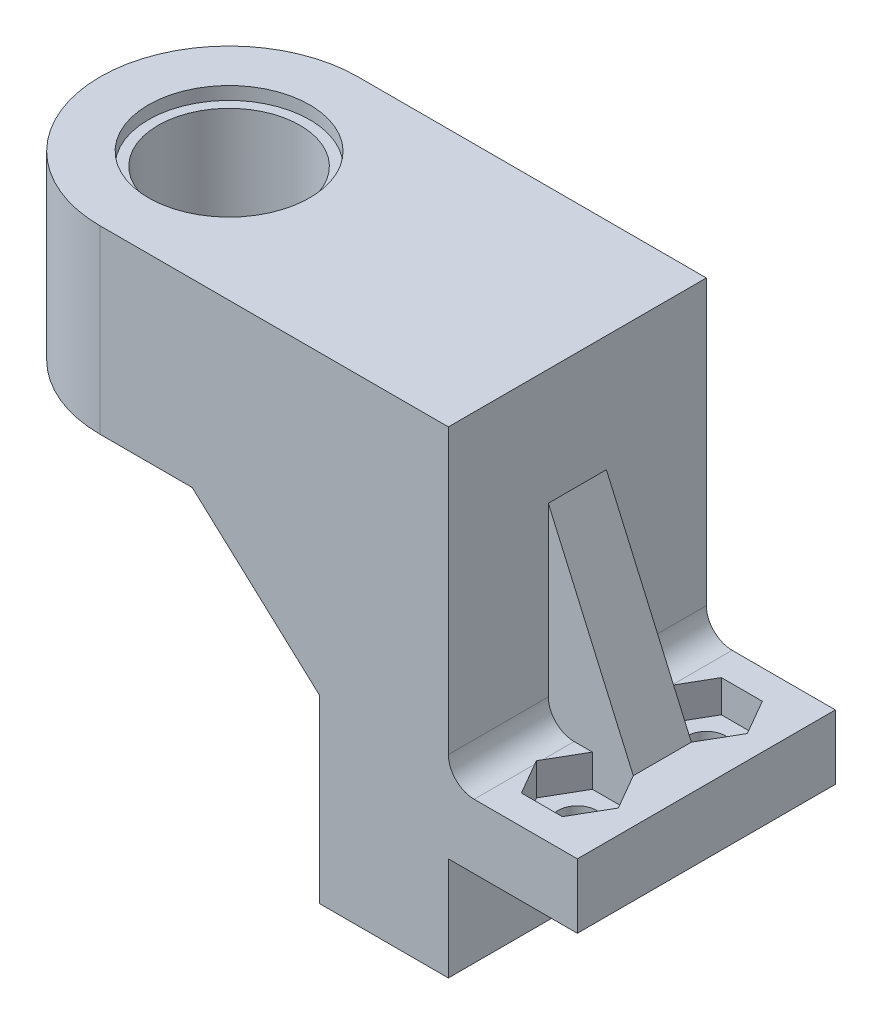
from build123d import *
from build123d.topology import SkipClean

# Parameters (mm, degrees)
EXTRUDE_1_DEPTH           = 20
SKETCH_3_R                = 5.5
CUT_EXTRUDE_2_DEPTH       = 10
SKETCH_9_R                = 6.25
CUT_EXTRUDE_6_DEPTH       = 1
SKETCH_11_W               = 20
SKETCH_11_H               = 5
EXTRUDE_4_DEPTH           = 10
CUT_EXTRUDE_8_REACH       = 78.472
SKETCH_12_R               = 1.5
SKETCH_13_R               = 3
CUT_EXTRUDE_9_DEPTH       = 2.5
SKETCH_14_R               = 10
SKETCH_14_R_2             = 5.5
EXTRUDE_5_DEPTH           = 6
CUT_EXTRUDE_START         = -1
SKETCH_6_R                = 6.25
CUT_EXTRUDE_10_DEPTH      = 1
SKETCH_15_W               = 20
SKETCH_15_H               = 5
EXTRUDE_6_DEPTH           = 5
SKETCH_16_W               = 17
SKETCH_16_H               = 3
EXTRUDE_7_DEPTH           = 15
CUT_EXTRUDE_11_DEPTH      = 70.961190435
CUT_EXTRUDE_11_DEPTH_BACK = 70.961190435
EXTRUDE_START             = -5
SKETCH_3D_3_R             = 1.5
EXTRUDE_8_DEPTH           = 5
CUT_EXTRUDE_12_DEPTH      = 2.5
FILLET_1_R                = 2
CUT_EXTRUDE_14_DEPTH      = 76.06644022
SKETCH_21_W               = 6.587713241
SKETCH_21_H               = 4.5
EXTRUDE_9_DEPTH           = 15
SKETCH_23_W               = 25
SKETCH_23_H               = 20
CUT_EXTRUDE_16_DEPTH      = 5
CUT_EXTRUDE_17_DEPTH      = 10


with BuildPart() as part:
    # 草图1 → 凸台-拉伸1 (new body)
    with BuildSketch(Plane.XY):
        Polygon((-63.866818046, 22.947717095), (-23.866818046, 22.947717095), (-23.866818046, -19.052282905), (-33.866818046, -19.052282905), (-33.866818046, 14.947717095), (-63.866818046, 14.947717095), align=None)
    extrude(amount=EXTRUDE_1_DEPTH)

    # 草图3 → 切除-拉伸2 (cut)
    with BuildSketch(Plane(origin=(0, 22.947717095, 0), x_dir=(-1, 0, 0), z_dir=(0, 1, 0))):
        with Locations((50.866818046, 10)):
            Circle(SKETCH_3_R)
    extrude(amount=-CUT_EXTRUDE_2_DEPTH, mode=Mode.SUBTRACT)

    # 草图9 → 切除-拉伸6 (cut)
    with BuildSketch(Plane(origin=(0, 22.947717095, 0), x_dir=(1, 0, 0), z_dir=(0, 1, 0))):
        with Locations(Location((-50.866818046, -10, 0), (0, 0, 180))):
            Circle(SKETCH_9_R)
    extrude(amount=-CUT_EXTRUDE_6_DEPTH, mode=Mode.SUBTRACT)

    # 草图11 → 凸台-拉伸4 (add)
    with BuildSketch(Plane(origin=(-23.866818046, 0, 0), x_dir=(0, 0, -1), z_dir=(1, 0, 0))):
        with Locations((-10, -16.552282905)):
            Rectangle(SKETCH_11_W, SKETCH_11_H)
    extrude(amount=EXTRUDE_4_DEPTH)

    # 草图12 → 切除-拉伸8 (cut, up to next)
    with BuildSketch(Plane(origin=(0, -14.052282905, 0), x_dir=(-1, 0, 0), z_dir=(0, 1, 0)), mode=Mode.PRIVATE) as cut_extrude_8_sk1:
        with Locations((18.866818046, 5)):
            Circle(SKETCH_12_R)
    cut_extrude_8_tool1 = extrude(cut_extrude_8_sk1.sketch, amount=-CUT_EXTRUDE_8_REACH, mode=Mode.PRIVATE) & part.part
    # 草图12 → 切除-拉伸8 (cut, up to next)
    with BuildSketch(Plane(origin=(0, -14.052282905, 0), x_dir=(-1, 0, 0), z_dir=(0, 1, 0)), mode=Mode.PRIVATE) as cut_extrude_8_sk2:
        with Locations((18.866818046, 15)):
            Circle(SKETCH_12_R)
    cut_extrude_8_tool2 = extrude(cut_extrude_8_sk2.sketch, amount=-CUT_EXTRUDE_8_REACH, mode=Mode.PRIVATE) & part.part
    add(cut_extrude_8_tool1.solids().sort_by_distance((-18.866818, -14.052283, 5))[0], mode=Mode.SUBTRACT)
    add(cut_extrude_8_tool2.solids().sort_by_distance((-18.866818, -14.052283, 15))[0], mode=Mode.SUBTRACT)

    # 草图13 → 切除-拉伸9 (cut)
    with BuildSketch(Plane.XZ.offset(19.052282905)):
        with Locations(Location((-18.866818046, 15, 0), (0, 0, 270))):
            Circle(SKETCH_13_R)
        with Locations(Location((-18.866818046, 5, 0), (0, 0, 270))):
            Circle(SKETCH_13_R)
    extrude(amount=-CUT_EXTRUDE_9_DEPTH, mode=Mode.SUBTRACT)

    # 草图14 → 凸台-拉伸5 (add)
    with SkipClean():  # the faces are left unmerged after this step: merging them gives an invalid solid
        with BuildSketch(Plane.XZ.offset(-14.947717095)):
            with Locations(Location((-50.866818046, 10, 0), (0, 0, 270))):
                Circle(SKETCH_14_R)
            with Locations(Location((-50.866818046, 10, 0), (0, 0, 180))):
                Circle(SKETCH_14_R_2, mode=Mode.SUBTRACT)
        extrude(amount=EXTRUDE_5_DEPTH)

    # 草图6 → 切除-拉伸10 (cut)
    with BuildSketch(Plane.XZ.offset(-8.947717095).offset(CUT_EXTRUDE_START)):
        with Locations(Location((-50.866818046, 10, 0), (0, 0, 180))):
            Circle(SKETCH_6_R)
    extrude(amount=CUT_EXTRUDE_10_DEPTH, mode=Mode.SUBTRACT)

    # 草图15 → 凸台-拉伸6 (add)
    with BuildSketch(Plane(origin=(-13.866818046, 0, 0), x_dir=(0, 0, -1), z_dir=(1, 0, 0))):
        with Locations((-10, -16.552282905)):
            Rectangle(SKETCH_15_W, SKETCH_15_H)
    extrude(amount=EXTRUDE_6_DEPTH)

    # 草图16 → 凸台-拉伸7 (add)
    with BuildSketch(Plane.XZ.offset(-14.947717095)):
        with Locations((-42.366818046, 18.5)):
            Rectangle(SKETCH_16_W, SKETCH_16_H)
        with Locations((-42.366818046, 1.5)):
            Rectangle(SKETCH_16_W, SKETCH_16_H)
    extrude(amount=EXTRUDE_7_DEPTH)

    # 草图17 → 切除-拉伸11 (cut, two sides: drawn at the far end of the back side and taken through both)
    with BuildSketch(Plane(origin=(0, 0, 17), x_dir=(-1, 0, 0), z_dir=(0, 0, -1)).offset(-CUT_EXTRUDE_11_DEPTH_BACK)):
        Polygon((50.866818046, 8.947717095), (43.725389617, 8.947717095), (33.866818046, -0.052282905), (50.866818046, -0.052282905), align=None)
    extrude(amount=CUT_EXTRUDE_11_DEPTH + CUT_EXTRUDE_11_DEPTH_BACK, mode=Mode.SUBTRACT)

    # Sketch 3D_3 → 凸台-拉伸8 (add)
    with BuildSketch(Plane(origin=(-23.866818046, -6.052282905, 20), x_dir=(0.447213595499958, 0, -0.894427190999916), z_dir=(0, -1, 0)).offset(EXTRUDE_START)):
        Polygon((0, 0), (4.472135955, 8.94427191), (22.360679775, 0), (17.88854382, -8.94427191), align=None)
        with Locations(Location((6.708203932, 2.236067977, 0), (0, 0, 243.434948823))):
            Circle(SKETCH_3D_3_R, mode=Mode.SUBTRACT)
        with Locations(Location((15.652475842, -2.236067977, 0), (0, 0, 243.434948823))):
            Circle(SKETCH_3D_3_R, mode=Mode.SUBTRACT)
    extrude(amount=EXTRUDE_8_DEPTH)

    # 草图18 → 切除-拉伸12 (cut)
    with BuildSketch(Plane(origin=(0, -1.052282905, 0), x_dir=(-1, 0, 0), z_dir=(0, 1, 0))):
        Polygon((15.691391565, 15), (17.279104805, 12.25), (20.454531286, 12.25), (22.042244526, 15), (20.454531286, 17.75), (17.279104805, 17.75), align=None)
        Polygon((15.691391565, 5), (17.279104805, 2.25), (20.454531286, 2.25), (22.042244526, 5), (20.454531286, 7.75), (17.279104805, 7.75), align=None)
    extrude(amount=-CUT_EXTRUDE_12_DEPTH, mode=Mode.SUBTRACT)

    # 圆角1
    # the kernel refuses this fillet: 2 mm, written as the material it adds along each edge
    with BuildSketch(Plane(origin=(-23.866818046, -1.052282905, 0), x_dir=(0, 1, 0), z_dir=(0, 0, 1))) as fillet_1_piece_1_section:
        with BuildLine():
            CenterArc((FILLET_1_R, -FILLET_1_R), FILLET_1_R, 90, 90)
            Line((0, -FILLET_1_R), (0, 0))
            Line((0, 0), (FILLET_1_R, 0))
        make_face()
    fillet_1_piece_1 = extrude(amount=20, mode=Mode.PRIVATE)
    fillet_1_piece_1 = split(fillet_1_piece_1, bisect_by=Plane(origin=(-20.802583542, -0.671658343, 2.852844192), z_dir=(-0.8660254037844387, 0, -0.5000000000000001)), keep=Keep.TOP, mode=Mode.PRIVATE)
    fillet_1_piece_1 = split(fillet_1_piece_1, bisect_by=Plane(origin=(-23.907001975, -0.671658343, 1.770145354), z_dir=(0.8660254037844387, 0, -0.5000000000000003)), keep=Keep.TOP, mode=Mode.PRIVATE)
    add(fillet_1_piece_1)
    with BuildSketch(Plane(origin=(-23.866818046, -1.052282905, 0), x_dir=(0, 1, 0), z_dir=(0, 0, 1))) as fillet_1_piece_2_section:
        with BuildLine():
            CenterArc((FILLET_1_R, -FILLET_1_R), FILLET_1_R, 90, 90)
            Line((0, -FILLET_1_R), (0, 0))
            Line((0, 0), (FILLET_1_R, 0))
        make_face()
    fillet_1_piece_2 = extrude(amount=20, mode=Mode.PRIVATE)
    fillet_1_piece_2 = split(fillet_1_piece_2, bisect_by=Plane(origin=(-22.4188867, -0.519681884, 5.652363381), z_dir=(-0.8660254037844387, 0, -0.5000000000000001)), keep=Keep.TOP, mode=Mode.PRIVATE)
    fillet_1_piece_2 = split(fillet_1_piece_2, bisect_by=Plane(origin=(-22.4188867, -0.519681884, 4.347636619), z_dir=(-0.8660254037844387, 0, 0.5000000000000003)), keep=Keep.TOP, mode=Mode.PRIVATE)
    add(fillet_1_piece_2)
    with BuildSketch(Plane(origin=(-23.866818046, -1.052282905, 0), x_dir=(0, 1, 0), z_dir=(0, 0, 1))) as fillet_1_piece_3_section:
        with BuildLine():
            CenterArc((FILLET_1_R, -FILLET_1_R), FILLET_1_R, 90, 90)
            Line((0, -FILLET_1_R), (0, 0))
            Line((0, 0), (FILLET_1_R, 0))
        make_face()
    fillet_1_piece_3 = extrude(amount=20, mode=Mode.PRIVATE)
    fillet_1_piece_3 = split(fillet_1_piece_3, bisect_by=Plane(origin=(-24.519856268, -0.671658343, 9.291349419), z_dir=(0.8660254037844387, 0, 0.5000000000000001)), keep=Keep.TOP, mode=Mode.PRIVATE)
    fillet_1_piece_3 = split(fillet_1_piece_3, bisect_by=Plane(origin=(-20.189729249, -0.671658343, 8.208650581), z_dir=(-0.8660254037844387, 0, 0.5000000000000003)), keep=Keep.TOP, mode=Mode.PRIVATE)
    fillet_1_piece_3 = split(fillet_1_piece_3, bisect_by=Plane(origin=(-20.189729249, -0.671658343, 11.791349419), z_dir=(-0.8660254037844387, 0, -0.5)), keep=Keep.TOP, mode=Mode.PRIVATE)
    fillet_1_piece_3 = split(fillet_1_piece_3, bisect_by=Plane(origin=(-24.519856268, -0.671658343, 10.708650581), z_dir=(0.8660254037844384, 0, -0.5000000000000004)), keep=Keep.TOP, mode=Mode.PRIVATE)
    add(fillet_1_piece_3)
    with BuildSketch(Plane(origin=(-23.866818046, -1.052282905, 0), x_dir=(0, 1, 0), z_dir=(0, 0, 1))) as fillet_1_piece_4_section:
        with BuildLine():
            CenterArc((FILLET_1_R, -FILLET_1_R), FILLET_1_R, 90, 90)
            Line((0, -FILLET_1_R), (0, 0))
            Line((0, 0), (FILLET_1_R, 0))
        make_face()
    fillet_1_piece_4 = extrude(amount=20, mode=Mode.PRIVATE)
    fillet_1_piece_4 = split(fillet_1_piece_4, bisect_by=Plane(origin=(-22.4188867, -0.519681884, 15.652363381), z_dir=(-0.8660254037844387, 0, -0.5)), keep=Keep.TOP, mode=Mode.PRIVATE)
    fillet_1_piece_4 = split(fillet_1_piece_4, bisect_by=Plane(origin=(-22.4188867, -0.519681884, 14.347636619), z_dir=(-0.8660254037844384, 0, 0.5000000000000004)), keep=Keep.TOP, mode=Mode.PRIVATE)
    add(fillet_1_piece_4)
    with BuildSketch(Plane(origin=(-23.866818046, -1.052282905, 0), x_dir=(0, 1, 0), z_dir=(0, 0, 1))) as fillet_1_piece_5_section:
        with BuildLine():
            CenterArc((FILLET_1_R, -FILLET_1_R), FILLET_1_R, 90, 90)
            Line((0, -FILLET_1_R), (0, 0))
            Line((0, 0), (FILLET_1_R, 0))
        make_face()
    fillet_1_piece_5 = extrude(amount=20, mode=Mode.PRIVATE)
    fillet_1_piece_5 = split(fillet_1_piece_5, bisect_by=Plane(origin=(-23.907001975, -0.671658343, 18.229854646), z_dir=(0.8660254037844387, 0, 0.5)), keep=Keep.TOP, mode=Mode.PRIVATE)
    fillet_1_piece_5 = split(fillet_1_piece_5, bisect_by=Plane(origin=(-20.802583542, -0.671658343, 17.147155808), z_dir=(-0.8660254037844384, 0, 0.5000000000000004)), keep=Keep.TOP, mode=Mode.PRIVATE)
    add(fillet_1_piece_5)

    # 草图20 → 切除-拉伸14 (cut, through all)
    with SkipClean():  # the faces are left unmerged after this step: merging them gives an invalid solid
        with BuildSketch(Plane.XZ.offset(-14.947717095)):
            with BuildLine():
                Line((-63.866818046, 20), (-50.866818046, 20))
                ThreePointArc((-50.866818046, 20), (-60.866818046, 10), (-50.866818046, 0))
                Line((-50.866818046, 0), (-63.866818046, 0))
                Line((-63.866818046, 0), (-63.866818046, 20))
            make_face()
        extrude(amount=-CUT_EXTRUDE_14_DEPTH, mode=Mode.SUBTRACT)
    add(part.part.scale(1), mode=Mode.REPLACE)  # the faces are merged on a copy

    # 草图21 → 凸台-拉伸9 (add)
    with BuildSketch(Plane(origin=(0, -1.052282905, 0), x_dir=(1, 0, 0), z_dir=(0, 1, 0))):
        with Locations((-20.572961426, -10)):
            Rectangle(SKETCH_21_W, SKETCH_21_H)
    extrude(amount=EXTRUDE_9_DEPTH)

    # 草图23 → 切除-拉伸16 (cut)
    with BuildSketch(Plane.XZ.offset(19.052282905)):
        with Locations((-21.366818046, 10)):
            Rectangle(SKETCH_23_W, SKETCH_23_H)
    extrude(amount=-CUT_EXTRUDE_16_DEPTH, mode=Mode.SUBTRACT)

    # 草图24 → 切除-拉伸17 (cut)
    with BuildSketch(Plane.XY.offset(12.25)):
        Polygon((-23.866818046, 13.947717095), (-17.279104805, -1.052282905), (-17.279104805, 13.947717095), align=None)
    extrude(amount=-CUT_EXTRUDE_17_DEPTH, mode=Mode.SUBTRACT)


solid = part.part
